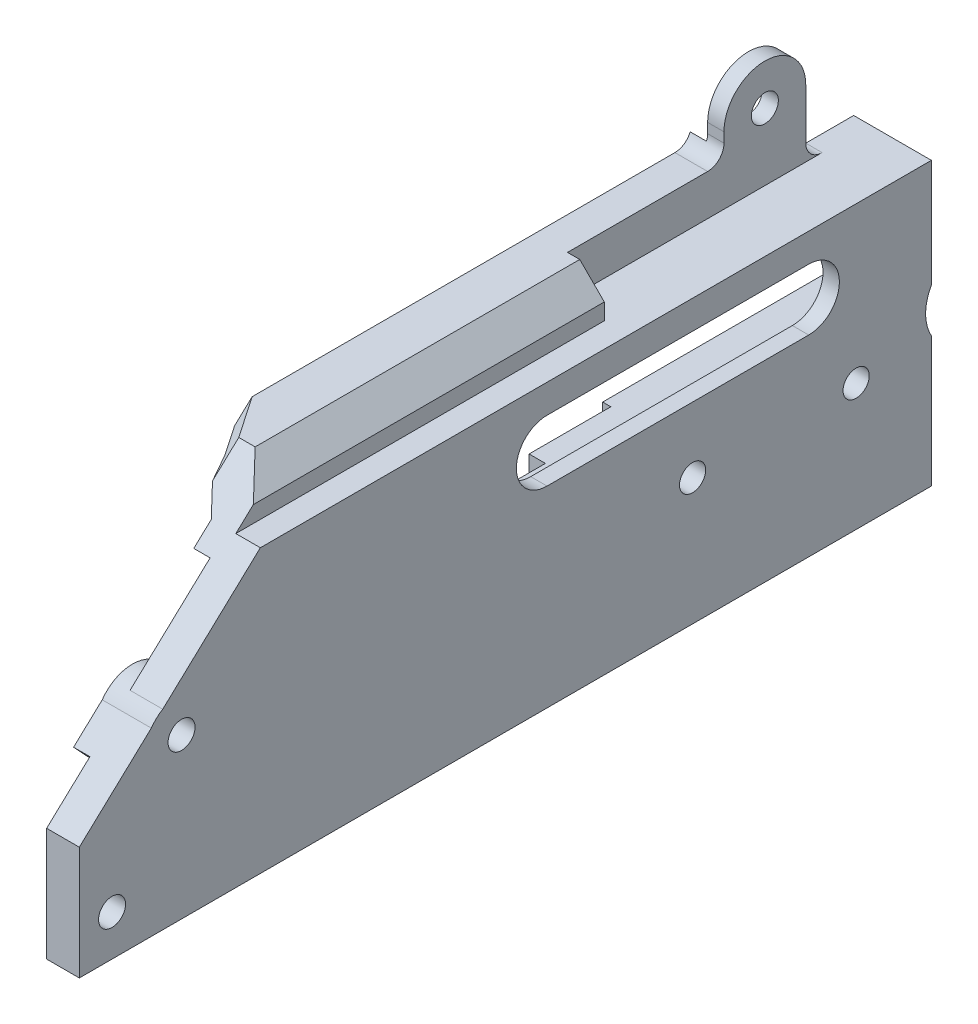
from build123d import *

# Parameters (mm, degrees)
SKETCH_1_W           = 33.2
SKETCH_1_H           = 22
SKETCH_1_R           = 1.6
EXTRUDE_1_DEPTH      = 7
SKETCH_2_W           = 33.2
SKETCH_2_H           = 10.5
EXTRUDE_2_DEPTH      = 2
EXTRUDE_3_DEPTH      = 60
SKETCH_4_W           = 2
SKETCH_4_H           = 10.5
EXTRUDE_4_DEPTH      = 38.5
SKETCH_5_W           = 4
SKETCH_5_H           = 10.5
EXTRUDE_5_DEPTH      = 2
SKETCH_6_W           = 4
SKETCH_6_H           = 10.5
EXTRUDE_6_DEPTH      = 19.5
SKETCH_7_W           = 6
SKETCH_7_H           = 93.2
EXTRUDE_7_DEPTH      = 2
SKETCH_8_W           = 93.2
SKETCH_8_H           = 5
EXTRUDE_8_DEPTH      = 3
SKETCH_10_W          = 93.2
SKETCH_10_H          = 2
EXTRUDE_9_DEPTH      = 5.5
SKETCH_12_W          = 18
SKETCH_12_H          = 2
CUT_EXTRUDE_1_DEPTH  = 5.5
SKETCH_13_W          = 40
SKETCH_13_H          = 5
EXTRUDE_10_DEPTH     = 3.5
CUT_EXTRUDE_2_REACH  = 70.879
SKETCH_15_W          = 15.5
SKETCH_15_H          = 5
SKETCH_16_W          = 3.5
SKETCH_16_H          = 2.5
EXTRUDE_12_DEPTH     = 2
CUT_EXTRUDE_3_REACH  = 71.313
CHAMFER_1_SIZE       = 3.5
SKETCH_18_R          = 1.65
EXTRUDE_13_DEPTH     = 2
FILLET_1_R           = 2
SKETCH_19_W          = 4.5
SKETCH_19_H          = 21.5
CUT_EXTRUDE_4_DEPTH  = 5
CHAMFER_2_SIZE       = 3
CUT_EXTRUDE_5_REACH  = 74.561
SKETCH_20_R          = 1.65
EXTRUDE_14_REACH     = 73.895
SKETCH_21_R          = 4.5
SKETCH_21_R_2        = 1.65
EXTRUDE_15_DEPTH     = 6
EXTRUDE_16_DEPTH     = 4
CUT_EXTRUDE_6_REACH  = 83.84
SKETCH_24_R          = 1.65
CUT_EXTRUDE_7_REACH  = 84.171
SKETCH_26_W          = 2
SKETCH_26_H          = 10.5
CUT_EXTRUDE_8_DEPTH  = 5
SKETCH_27_W          = 2
SKETCH_27_H          = 2
EXTRUDE_17_DEPTH     = 10
CUT_EXTRUDE_9_DEPTH  = 2
CUT_EXTRUDE_10_REACH = 84.426
SKETCH_29_R          = 5.5
SKETCH_30_W          = 63
SKETCH_30_H          = 2
EXTRUDE_18_DEPTH     = 1


with BuildPart() as part:
    # 草图1 → 凸台-拉伸1 (new body)
    with BuildSketch(Plane(origin=(0, 0, 0), x_dir=(0, 0, -1), z_dir=(1, 0, 0))):
        with Locations((12.6, -4.5)):
            Rectangle(SKETCH_1_W, SKETCH_1_H)
        Circle(SKETCH_1_R, mode=Mode.SUBTRACT)
        with Locations((20, 0)):
            Circle(SKETCH_1_R, mode=Mode.SUBTRACT)
    extrude(amount=EXTRUDE_1_DEPTH)

    # 草图2 → 凸台-拉伸2 (add)
    with BuildSketch(Plane(origin=(7, 0, 0), x_dir=(0, 0, -1), z_dir=(1, 0, 0))):
        with Locations((12.6, 11.75)):
            Rectangle(SKETCH_2_W, SKETCH_2_H)
    extrude(amount=-EXTRUDE_2_DEPTH)

    # 草图3 → 凸台-拉伸3 (add)
    with BuildSketch(Plane.XY.offset(4)):
        Polygon((7, -15.5), (1, -15.5), (1, 4.5), (3, 4.5), (3, 6.5), (7, 6.5), align=None)
    extrude(amount=EXTRUDE_3_DEPTH)

    # 草图4 → 凸台-拉伸4 (add)
    with BuildSketch(Plane.XY.offset(4)):
        with Locations((6, 11.75)):
            Rectangle(SKETCH_4_W, SKETCH_4_H)
    extrude(amount=EXTRUDE_4_DEPTH)

    # 草图5 → 凸台-拉伸5 (add)
    with BuildSketch(Plane.XY.offset(42.5)):
        with Locations((5, 11.75)):
            Rectangle(SKETCH_5_W, SKETCH_5_H)
    extrude(amount=EXTRUDE_5_DEPTH)

    # 草图6 → 凸台-拉伸6 (add)
    with BuildSketch(Plane.XY.offset(44.5)):
        with Locations((5, 11.75)):
            Rectangle(SKETCH_6_W, SKETCH_6_H)
    extrude(amount=EXTRUDE_6_DEPTH)

    # 草图7 → 凸台-拉伸7 (add)
    with BuildSketch(Plane(origin=(0, 17, 0), x_dir=(1, 0, 0), z_dir=(0, 1, 0))):
        with Locations((4, -17.4)):
            Rectangle(SKETCH_7_W, SKETCH_7_H)
    extrude(amount=EXTRUDE_7_DEPTH)

    # 草图8 → 凸台-拉伸8 (add)
    with BuildSketch(Plane.ZY.offset(-1)):
        with Locations((17.4, 21.5)):
            Rectangle(SKETCH_8_W, SKETCH_8_H)
    extrude(amount=-EXTRUDE_8_DEPTH)

    # 草图10 → 凸台-拉伸9 (add)
    with BuildSketch(Plane.ZY.offset(-1)):
        with Locations((17.4, 23)):
            Rectangle(SKETCH_10_W, SKETCH_10_H)
    extrude(amount=EXTRUDE_9_DEPTH)

    # 草图12 → 切除-拉伸1 (cut)
    with BuildSketch(Plane.ZY.offset(4.5)):
        with Locations((-20.2, 23)):
            Rectangle(SKETCH_12_W, SKETCH_12_H)
    extrude(amount=-CUT_EXTRUDE_1_DEPTH, mode=Mode.SUBTRACT)

    # 草图13 → 凸台-拉伸10 (add)
    with BuildSketch(Plane.ZY.offset(-1)):
        with Locations((-9.2, 19.5)):
            Rectangle(SKETCH_13_W, SKETCH_13_H)
    extrude(amount=EXTRUDE_10_DEPTH)

    # 草图15 → 切除-拉伸2 (cut, up to next)
    with BuildSketch(Plane(origin=(4, 0, 0), x_dir=(0, 0, -1), z_dir=(1, 0, 0)), mode=Mode.PRIVATE) as cut_extrude_2_sk1:
        with Locations((21.45, 21.5)):
            Rectangle(SKETCH_15_W, SKETCH_15_H)
    cut_extrude_2_tool1 = extrude(cut_extrude_2_sk1.sketch, amount=-CUT_EXTRUDE_2_REACH, mode=Mode.PRIVATE) & part.part
    add(cut_extrude_2_tool1.solids().sort_by_distance((4, 21.5, -21.45))[0], mode=Mode.SUBTRACT)

    # 草图16 → 凸台-拉伸12 (add)
    with BuildSketch(Plane(origin=(0, 22, 0), x_dir=(1, 0, 0), z_dir=(0, 1, 0))):
        with Locations((-0.75, 12.45)):
            Rectangle(SKETCH_16_W, SKETCH_16_H)
    extrude(amount=EXTRUDE_12_DEPTH)

    # 草图17 → 切除-拉伸3 (cut, up to next)
    with BuildSketch(Plane(origin=(7, 0, 0), x_dir=(0, 0, -1), z_dir=(1, 0, 0)), mode=Mode.PRIVATE) as cut_extrude_3_sk1:
        Polygon((-47.5, 24), (-64, 8.613501079), (-64, 24), align=None)
    cut_extrude_3_tool1 = extrude(cut_extrude_3_sk1.sketch, amount=-CUT_EXTRUDE_3_REACH, mode=Mode.PRIVATE) & part.part
    add(cut_extrude_3_tool1.solids().sort_by_distance((7, 18.871167, 58.5))[0], mode=Mode.SUBTRACT)

    # 倒角1
    # the kernel refuses this chamfer: 3.5 mm, written as the material it takes off along each edge
    with BuildSketch(Plane(origin=(-4.5, 15.861407469, 56.227571974), x_dir=(0.9996219169112969, 0.020109211138415985, 0.018752142756900524), z_dir=(0, 0.6819983600625026, -0.7313537016191667))) as chamfer_1_piece_1:
        Polygon((CHAMFER_1_SIZE * 0.999621916911, CHAMFER_1_SIZE * 0.0274958766106), (-CHAMFER_1_SIZE * 0.0274958766106, CHAMFER_1_SIZE * 0.999621916911), (0, 0), align=None)
    extrude(amount=20.934339287, mode=Mode.SUBTRACT)

    # 草图18 → 凸台-拉伸13 (add)
    with BuildSketch(Plane.ZY.offset(2.5)):
        with BuildLine():
            Line((-11.337, 27.2), (-11.337, 24))
            Line((-11.337, 24), (-13.7, 24))
            Line((-13.7, 24), (-13.7, 19))
            Line((-13.7, 19), (-21.337, 19))
            Line((-21.337, 19), (-21.337, 27.2))
            ThreePointArc((-21.337, 27.2), (-16.337, 32.2), (-11.337, 27.2))
        make_face()
        with Locations((-16.337, 27.2)):
            Circle(SKETCH_18_R, mode=Mode.SUBTRACT)
    extrude(amount=-EXTRUDE_13_DEPTH)

    # 圆角1
    fillet_1_edges = [part.edges().sort_by_distance(p)[0] for p in [
        (-1.5, 24, -11.337),
        (-1.5, 19, -21.337),
    ]]
    fillet(fillet_1_edges, radius=FILLET_1_R)

    # 草图19 → 切除-拉伸4 (cut)
    with BuildSketch(Plane(origin=(0, 24, 0), x_dir=(1, 0, 0), z_dir=(0, 1, 0))):
        with Locations((1.75, 2.95)):
            Rectangle(SKETCH_19_W, SKETCH_19_H)
    extrude(amount=-CUT_EXTRUDE_4_DEPTH, mode=Mode.SUBTRACT)

    # 倒角2
    chamfer_2_edges = [part.edges().sort_by_distance(p)[0] for p in [
        (4, 24, 27.65),
        (1, 22, 30.22236871),
    ]]
    chamfer(chamfer_2_edges, length=CHAMFER_2_SIZE)

    # 草图20 → 切除-拉伸5 (cut, up to next)
    with BuildSketch(Plane(origin=(7, 0, 0), x_dir=(0, 0, -1), z_dir=(1, 0, 0)), mode=Mode.PRIVATE) as cut_extrude_5_sk1:
        with Locations((-62.5, 4)):
            Circle(SKETCH_20_R)
    cut_extrude_5_tool1 = extrude(cut_extrude_5_sk1.sketch, amount=-CUT_EXTRUDE_5_REACH, mode=Mode.PRIVATE) & part.part
    add(cut_extrude_5_tool1.solids().sort_by_distance((7, 4, 62.5))[0], mode=Mode.SUBTRACT)

    # 凸台-拉伸14: up to this face of the body (flat: up to its plane)
    extrude_14_end = Plane(part.part.faces().sort_by_distance((7, 1.498387626, 16.627822956))[0])
    # 草图21 → 凸台-拉伸14 (add, up to the picked face)
    with BuildSketch(Plane.ZY.offset(-1), mode=Mode.PRIVATE) as extrude_14_sk1:
        with Locations((62.5, 4)):
            Circle(SKETCH_21_R)
        with Locations(Location((62.5, 4, 0), (0, 0, 180))):
            Circle(SKETCH_21_R_2, mode=Mode.SUBTRACT)
    extrude_14_tool1 = split(extrude(extrude_14_sk1.sketch, amount=-EXTRUDE_14_REACH, mode=Mode.PRIVATE), bisect_by=extrude_14_end, keep=Keep.BOTH, mode=Mode.PRIVATE)
    add(extrude_14_tool1.solids().sort_by(Axis((1, 4, 58.127279), (1, 0, 0)))[0])

    # 草图22 → 凸台-拉伸15 (add)
    with BuildSketch(Plane.ZY.offset(-1)):
        with BuildLine():
            Line((66.198595209, 6.563277878), (75, -1.644164869))
            Line((75, -1.644164869), (75, -15.5))
            Line((75, -15.5), (64, -15.5))
            Line((64, -15.5), (64, -0.242640687))
            ThreePointArc((64, -0.242640687), (66.782111619, 2.616699568), (66.198595209, 6.563277878))
        make_face()
    extrude(amount=-EXTRUDE_15_DEPTH)

    # 草图23 → 凸台-拉伸16 (add)
    with BuildSketch(Plane(origin=(7, 0, 0), x_dir=(0, 0, -1), z_dir=(1, 0, 0))):
        Polygon((-64, 8.613501079), (-64.799032902, 7.868390843), (-64, 8.242640687), align=None)
    extrude(amount=-EXTRUDE_16_DEPTH)

    # 草图24 → 切除-拉伸6 (cut, up to next)
    with BuildSketch(Plane.ZY.offset(-1), mode=Mode.PRIVATE) as cut_extrude_6_sk1:
        with Locations(Location((71, -10.5, 0), (0, 0, 270))):
            Circle(SKETCH_24_R)
    cut_extrude_6_tool1 = extrude(cut_extrude_6_sk1.sketch, amount=-CUT_EXTRUDE_6_REACH, mode=Mode.PRIVATE) & part.part
    add(cut_extrude_6_tool1.solids().sort_by_distance((1, -10.5, 71))[0], mode=Mode.SUBTRACT)

    # 草图25 → 切除-拉伸7 (cut, up to next)
    with BuildSketch(Plane.ZY.offset(-5), mode=Mode.PRIVATE) as cut_extrude_7_sk1:
        with BuildLine():
            Line((17.8, 8), (-14.2, 8))
            ThreePointArc((-14.2, 8), (-17.95, 11.75), (-14.2, 15.5))
            Line((-14.2, 15.5), (17.8, 15.5))
            ThreePointArc((17.8, 15.5), (21.55, 11.75), (17.8, 8))
        make_face()
    cut_extrude_7_tool1 = extrude(cut_extrude_7_sk1.sketch, amount=-CUT_EXTRUDE_7_REACH, mode=Mode.PRIVATE) & part.part
    add(cut_extrude_7_tool1.solids().sort_by_distance((5, 11.75, 1.8))[0], mode=Mode.SUBTRACT)

    # 草图26 → 切除-拉伸8 (cut)
    with BuildSketch(Plane(origin=(0, 0, 42.5), x_dir=(-1, 0, 0), z_dir=(0, 0, -1))):
        with Locations((-4, 11.75)):
            Rectangle(SKETCH_26_W, SKETCH_26_H)
    extrude(amount=-CUT_EXTRUDE_8_DEPTH, mode=Mode.SUBTRACT)

    # 草图27 → 凸台-拉伸17 (add)
    with BuildSketch(Plane.XY.offset(4)):
        with Locations((2, 5.5)):
            Rectangle(SKETCH_27_W, SKETCH_27_H)
    extrude(amount=EXTRUDE_17_DEPTH)

    # 草图28 → 切除-拉伸9 (cut)
    with BuildSketch(Plane.ZY.offset(-1)):
        Polygon((67, 0.394553878), (67, -15.5), (75, -15.5), (75, -1.644164869), (69.70409784, 3.29434379), align=None)
    extrude(amount=-CUT_EXTRUDE_9_DEPTH, mode=Mode.SUBTRACT)

    # 草图29 → 切除-拉伸10 (cut, up to next)
    with BuildSketch(Plane(origin=(7, 0, 0), x_dir=(0, 0, -1), z_dir=(1, 0, 0)), mode=Mode.PRIVATE) as cut_extrude_10_sk1:
        with Locations((34, 3.1)):
            Circle(SKETCH_29_R)
    cut_extrude_10_tool1 = extrude(cut_extrude_10_sk1.sketch, amount=-CUT_EXTRUDE_10_REACH, mode=Mode.PRIVATE) & part.part
    add(cut_extrude_10_tool1.solids().sort_by_distance((7, 3.1, -34))[0], mode=Mode.SUBTRACT)

    # 草图30 → 凸台-拉伸18 (add)
    with BuildSketch(Plane.ZY.offset(-1)):
        with Locations((35.5, -5.5)):
            Rectangle(SKETCH_30_W, SKETCH_30_H)
    extrude(amount=EXTRUDE_18_DEPTH)


solid = part.part
